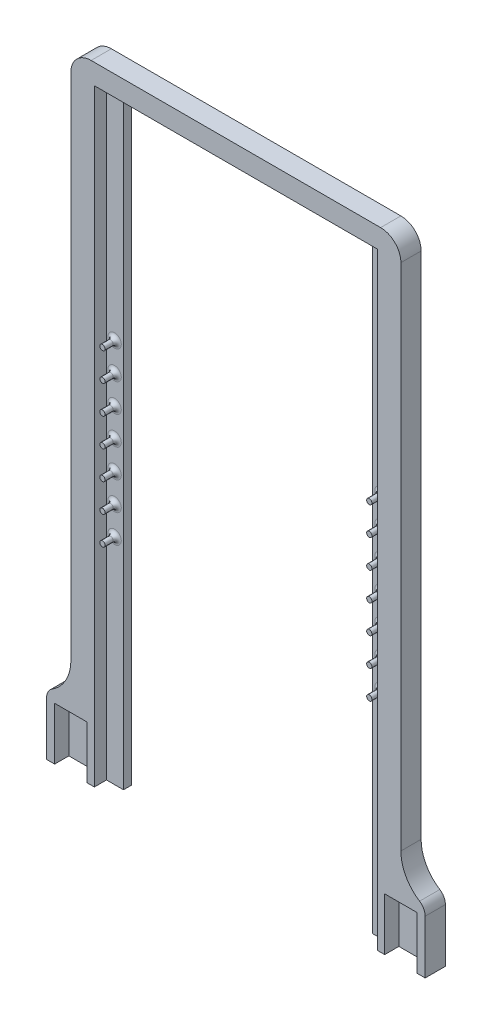
from build123d import *

# Parameters (mm, degrees)
STOCK_ARRAYRAMME_1_OUTLINE_R   = 0.65
STOCK_ARRAYRAMME_1_DEPTH       = 5
STOCK_ARRAYRAMME_1_2_OUTLINE_W = 4.2
STOCK_ARRAYRAMME_1_2_OUTLINE_H = 150
STOCK_ARRAYRAMME_1_2_OUTLINE_R = 0.65
STOCK_ARRAYRAMME_1_2_DEPTH     = 2
SKETCH1_W                      = 15
SKETCH1_H                      = 5
BOSS_EXTRUDE1_DEPTH            = 10
SKETCH2_W                      = 8
SKETCH2_H                      = 13
CUT_EXTRUDE1_DEPTH             = 162.97395624
SKETCH3_W                      = 15
SKETCH3_H                      = 5
BOSS_EXTRUDE2_DEPTH            = 10
SKETCH4_W                      = 8
SKETCH4_H                      = 13
CUT_EXTRUDE2_DEPTH             = 162.97395624
FILLET4_R                      = 1
SKETCH5_W                      = 8
SKETCH5_H                      = 1.5
BOSS_EXTRUDE3_DEPTH            = 13
SKETCH7_W                      = 140
SKETCH7_H                      = 5
BOSS_EXTRUDE4_DEPTH            = 4
SKETCH8_W                      = 140
SKETCH8_H                      = 5
BOSS_EXTRUDE5_DEPTH            = 4
FILLET5_R                      = 5
FILLET6_R                      = 10
FILLET7_R                      = 3


# Read off the part's stored shape, not the designer's step: Stock-arrayRamme-1
with BuildPart() as part:
    # Stock-arrayRamme-1 outline → Stock-arrayRamme-1 (new body)
    with BuildSketch(Plane.XY):
        Polygon((34.95, 150), (34.95, 0), (36.75, 0), (36.75, 155), (-36.75, 155), (-36.75, 0), (-34.95, 0), (-34.95, 150), align=None)
        with Locations((-32.95, 67)):
            Circle(STOCK_ARRAYRAMME_1_OUTLINE_R)
        with Locations((-32.95, 60)):
            Circle(STOCK_ARRAYRAMME_1_OUTLINE_R)
        with Locations((-32.95, 74)):
            Circle(STOCK_ARRAYRAMME_1_OUTLINE_R)
        with Locations((-32.95, 81)):
            Circle(STOCK_ARRAYRAMME_1_OUTLINE_R)
        with Locations((-32.95, 88)):
            Circle(STOCK_ARRAYRAMME_1_OUTLINE_R)
        with Locations((-32.95, 95)):
            Circle(STOCK_ARRAYRAMME_1_OUTLINE_R)
        with Locations((-32.95, 53)):
            Circle(STOCK_ARRAYRAMME_1_OUTLINE_R)
        with Locations((32.95, 67)):
            Circle(STOCK_ARRAYRAMME_1_OUTLINE_R)
        with Locations((32.95, 53)):
            Circle(STOCK_ARRAYRAMME_1_OUTLINE_R)
        with Locations((32.95, 60)):
            Circle(STOCK_ARRAYRAMME_1_OUTLINE_R)
        with Locations((32.95, 74)):
            Circle(STOCK_ARRAYRAMME_1_OUTLINE_R)
        with Locations((32.95, 81)):
            Circle(STOCK_ARRAYRAMME_1_OUTLINE_R)
        with Locations((32.95, 95)):
            Circle(STOCK_ARRAYRAMME_1_OUTLINE_R)
        with Locations((32.95, 88)):
            Circle(STOCK_ARRAYRAMME_1_OUTLINE_R)
    extrude(amount=STOCK_ARRAYRAMME_1_DEPTH)

    # Stock-arrayRamme-1 2 outline → Stock-arrayRamme-1 2 (add)
    # profile 1 of 2: a face of its own
    with BuildSketch(Plane.XY):
        with Locations((32.85, 75)):
            Rectangle(STOCK_ARRAYRAMME_1_2_OUTLINE_W, STOCK_ARRAYRAMME_1_2_OUTLINE_H)
        with Locations((32.95, 53)):
            Circle(STOCK_ARRAYRAMME_1_2_OUTLINE_R, mode=Mode.SUBTRACT)
        with Locations((32.95, 60)):
            Circle(STOCK_ARRAYRAMME_1_2_OUTLINE_R, mode=Mode.SUBTRACT)
        with Locations((32.95, 67)):
            Circle(STOCK_ARRAYRAMME_1_2_OUTLINE_R, mode=Mode.SUBTRACT)
        with Locations((32.95, 74)):
            Circle(STOCK_ARRAYRAMME_1_2_OUTLINE_R, mode=Mode.SUBTRACT)
        with Locations((32.95, 81)):
            Circle(STOCK_ARRAYRAMME_1_2_OUTLINE_R, mode=Mode.SUBTRACT)
        with Locations((32.95, 88)):
            Circle(STOCK_ARRAYRAMME_1_2_OUTLINE_R, mode=Mode.SUBTRACT)
        with Locations((32.95, 95)):
            Circle(STOCK_ARRAYRAMME_1_2_OUTLINE_R, mode=Mode.SUBTRACT)
    # profile 2 of 2: a face of its own
    with BuildSketch(Plane.XY):
        with Locations((-32.85, 75)):
            Rectangle(STOCK_ARRAYRAMME_1_2_OUTLINE_W, STOCK_ARRAYRAMME_1_2_OUTLINE_H)
        with Locations((-32.95, 53)):
            Circle(STOCK_ARRAYRAMME_1_2_OUTLINE_R, mode=Mode.SUBTRACT)
        with Locations((-32.95, 60)):
            Circle(STOCK_ARRAYRAMME_1_2_OUTLINE_R, mode=Mode.SUBTRACT)
        with Locations((-32.95, 67)):
            Circle(STOCK_ARRAYRAMME_1_2_OUTLINE_R, mode=Mode.SUBTRACT)
        with Locations((-32.95, 74)):
            Circle(STOCK_ARRAYRAMME_1_2_OUTLINE_R, mode=Mode.SUBTRACT)
        with Locations((-32.95, 81)):
            Circle(STOCK_ARRAYRAMME_1_2_OUTLINE_R, mode=Mode.SUBTRACT)
        with Locations((-32.95, 88)):
            Circle(STOCK_ARRAYRAMME_1_2_OUTLINE_R, mode=Mode.SUBTRACT)
        with Locations((-32.95, 95)):
            Circle(STOCK_ARRAYRAMME_1_2_OUTLINE_R, mode=Mode.SUBTRACT)
    extrude(amount=STOCK_ARRAYRAMME_1_2_DEPTH)

    # Sketch1 → Boss-Extrude1 (add)
    with BuildSketch(Plane.YZ.offset(36.75)):
        with Locations((7.5, 2.5)):
            Rectangle(SKETCH1_W, SKETCH1_H)
    extrude(amount=BOSS_EXTRUDE1_DEPTH)

    # Sketch2 → Cut-Extrude1 (cut, through all)
    with BuildSketch(Plane.XY.offset(5)):
        with Locations((40.75, 6.5)):
            Rectangle(SKETCH2_W, SKETCH2_H)
    extrude(amount=-CUT_EXTRUDE1_DEPTH, mode=Mode.SUBTRACT)

    # Sketch3 → Boss-Extrude2 (add)
    with BuildSketch(Plane(origin=(-36.75, 0, 0), x_dir=(0, -1, 0), z_dir=(-1, 0, 0))):
        with Locations((-7.5, 2.5)):
            Rectangle(SKETCH3_W, SKETCH3_H)
    extrude(amount=BOSS_EXTRUDE2_DEPTH)

    # Sketch4 → Cut-Extrude2 (cut, through all)
    with BuildSketch(Plane.XY.offset(5)):
        with Locations((-40.75, 6.5)):
            Rectangle(SKETCH4_W, SKETCH4_H)
    extrude(amount=-CUT_EXTRUDE2_DEPTH, mode=Mode.SUBTRACT)

    # Fillet4
    fillet4_edges = [part.edges().sort_by_distance(p)[0] for p in [
        (32.3, 60, 2),
        (32.3, 74, 2),
        (32.3, 81, 2),
        (32.3, 88, 2),
        (32.3, 95, 2),
        (-33.6, 95, 2),
        (-33.6, 88, 2),
        (-33.6, 81, 2),
        (-33.6, 74, 2),
        (-33.6, 60, 2),
        (32.3, 53, 2),
        (32.3, 67, 2),
        (-33.6, 67, 2),
        (-33.6, 53, 2),
    ]]
    fillet(fillet4_edges, radius=FILLET4_R)

    # Sketch5 → Boss-Extrude3 (add)
    with BuildSketch(Plane.XZ.offset(-13)):
        with Locations((40.75, 0.75)):
            Rectangle(SKETCH5_W, SKETCH5_H)
        with Locations((-40.75, 0.75)):
            Rectangle(SKETCH5_W, SKETCH5_H)
    extrude(amount=BOSS_EXTRUDE3_DEPTH)

    # Sketch7 → Boss-Extrude4 (add)
    with BuildSketch(Plane.YZ.offset(36.75)):
        with Locations((85, 2.5)):
            Rectangle(SKETCH7_W, SKETCH7_H)
    extrude(amount=BOSS_EXTRUDE4_DEPTH)

    # Sketch8 → Boss-Extrude5 (add)
    with BuildSketch(Plane(origin=(-36.75, 0, 0), x_dir=(0, -1, 0), z_dir=(-1, 0, 0))):
        with Locations((-85, 2.5)):
            Rectangle(SKETCH8_W, SKETCH8_H)
    extrude(amount=BOSS_EXTRUDE5_DEPTH)

    # Fillet5
    fillet5_edges = [part.edges().sort_by_distance(p)[0] for p in [
        (40.75, 155, 2.5),
        (-40.75, 155, 2.5),
    ]]
    fillet(fillet5_edges, radius=FILLET5_R)

    # Fillet6
    # the kernel refuses this fillet: 10 mm, written as the material it adds along each edge
    with BuildSketch(Plane(origin=(40.75, 15, 5), x_dir=(0, 1, 0), z_dir=(0, 0, -1)), Plane(origin=(-40.75, 15, 0), x_dir=(0, 1, 0), z_dir=(0, 0, 1))) as fillet6_piece_1:
        with BuildLine():
            CenterArc((9.16515139, 10), FILLET6_R, 203.578178478, 66.421821522)
            Line((0, 6), (-0.183303028, 5.92))
            ThreePointArc((-0.183303028, 5.92), (-0.2, 3), (-0.2, 0))
            Line((-0.2, 0), (0, -0.2))
            Line((0, -0.2), (9.16515139, -0.2))
            Line((9.16515139, -0.2), (9.16515139, 0))
        make_face()
    extrude(amount=5)

    # Fillet7
    fillet7_edges = [part.edges().sort_by_distance(p)[0] for p in [
        (-46.75, 15, 2.5),
        (46.75, 15, 2.5),
    ]]
    fillet(fillet7_edges, radius=FILLET7_R)


solid = part.part
